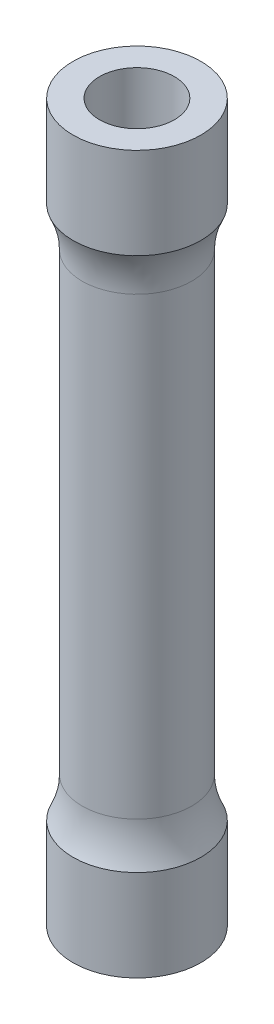
from build123d import *

# Parameters (mm, degrees)
Y_KSEKLIK_EKSTR_ZYON1_DEPTH      = 39.25
Y_KSEKLIK_EKSTR_ZYON1_DEPTH_BACK = 39.25
IZIM1_R                          = 6
IZIM1_R_2                        = 4.1
IZIM2_R                          = 7
IZIM2_R_2                        = 4.1
Y_KSEKLIK_EKSTR_ZYON2_DEPTH      = 10
RADYUS1_R                        = 10


with BuildPart() as part:
    # Çizim1 → Yükseklik-Ekstrüzyon1 (new, two sides: drawn at the far end of the back side and taken through both)
    with BuildSketch(Plane(origin=(0, 0, 0), x_dir=(1, 0, 0), z_dir=(0, 1, 0)).offset(-Y_KSEKLIK_EKSTR_ZYON1_DEPTH_BACK)):
        with Locations(Location((0, 0, 0), (0, 0, 270))):
            Circle(IZIM1_R)
        with Locations(Location((0, 0, 0), (0, 0, 270))):
            Circle(IZIM1_R_2, mode=Mode.SUBTRACT)
    extrude(amount=Y_KSEKLIK_EKSTR_ZYON1_DEPTH + Y_KSEKLIK_EKSTR_ZYON1_DEPTH_BACK)

    # Çizim2 → Yükseklik-Ekstrüzyon2 (add)
    with BuildSketch(Plane(origin=(0, 39.25, 0), x_dir=(1, 0, 0), z_dir=(0, 1, 0))):
        with Locations(Location((0, 0, 0), (0, 0, 270))):
            Circle(IZIM2_R)
        with Locations(Location((0, 0, 0), (0, 0, 270))):
            Circle(IZIM2_R_2, mode=Mode.SUBTRACT)
    y_kseklik_ekstr_zyon2 = extrude(amount=-Y_KSEKLIK_EKSTR_ZYON2_DEPTH)

    # Aynalama1: Yükseklik-Ekstrüzyon2 across plane
    add(y_kseklik_ekstr_zyon2.mirror(Plane.ZX))

    # Radyus1
    # the kernel refuses this fillet: 10 mm, written as the material it adds along each edge
    with BuildSketch(Plane(origin=(0, 29.25, 0), x_dir=(0, 0, 1), z_dir=(1, 0, 0))) as radyus1_piece_1:
        with BuildLine():
            CenterArc((16, 4.358898944), RADYUS1_R, 180, 25.841932763)
            Line((7, 0), (6.82, -0.087177979))
            ThreePointArc((6.82, -0.087177979), (6.5, -0.2), (6, -0.2))
            Line((6, -0.2), (5.8, 0))
            Line((5.8, 0), (5.8, 4.358898944))
            Line((5.8, 4.358898944), (6, 4.358898944))
        make_face()
    revolve(axis=Axis((0, 29.25, 0), (0, -1, 0)))
    with BuildSketch(Plane(origin=(0, -29.25, 0), x_dir=(0, 0, 1), z_dir=(-1, 0, 0))) as radyus1_piece_2:
        with BuildLine():
            CenterArc((16, 4.358898944), RADYUS1_R, 180, 25.841932763)
            Line((7, 0), (6.82, -0.087177979))
            ThreePointArc((6.82, -0.087177979), (6.5, -0.2), (6, -0.2))
            Line((6, -0.2), (5.8, 0))
            Line((5.8, 0), (5.8, 4.358898944))
            Line((5.8, 4.358898944), (6, 4.358898944))
        make_face()
    revolve(axis=Axis((0, -29.25, 0), (0, 1, 0)))


solid = part.part
